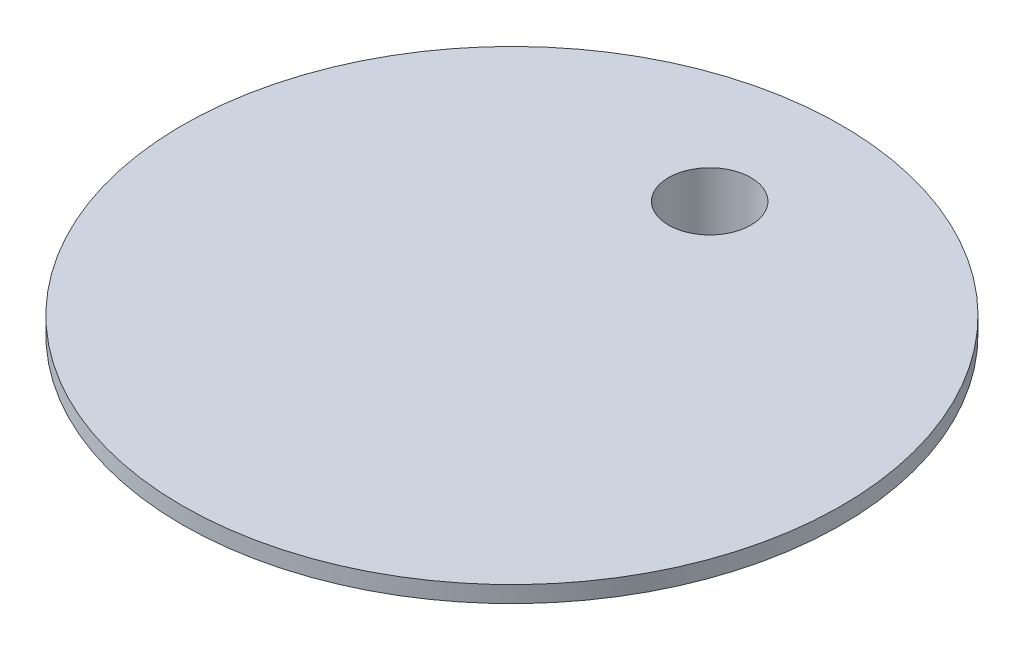
from build123d import *

# Parameters (mm, degrees)
SKETCH1_R           = 200
SKETCH1_R_2         = 25
BOSS_EXTRUDE1_DEPTH = 10
BOSS_EXTRUDE2_START = 85
SKETCH2_R           = 30
SKETCH2_R_2         = 25
BOSS_EXTRUDE2_DEPTH = 85


with BuildPart() as part:
    # Sketch1 → Boss-Extrude1 (new body)
    with BuildSketch(Plane(origin=(0, 0, 0), x_dir=(1, 0, 0), z_dir=(0, 1, 0))):
        Circle(SKETCH1_R)
        with Locations((0, 120)):
            Circle(SKETCH1_R_2, mode=Mode.SUBTRACT)
    extrude(amount=BOSS_EXTRUDE1_DEPTH)

    # Sketch2 → Boss-Extrude2 (add)
    with BuildSketch(Plane.XZ.offset(BOSS_EXTRUDE2_START)):
        with Locations((0, -120)):
            Circle(SKETCH2_R)
        with Locations((0, -120)):
            Circle(SKETCH2_R_2, mode=Mode.SUBTRACT)
    extrude(amount=-BOSS_EXTRUDE2_DEPTH)


solid = part.part
